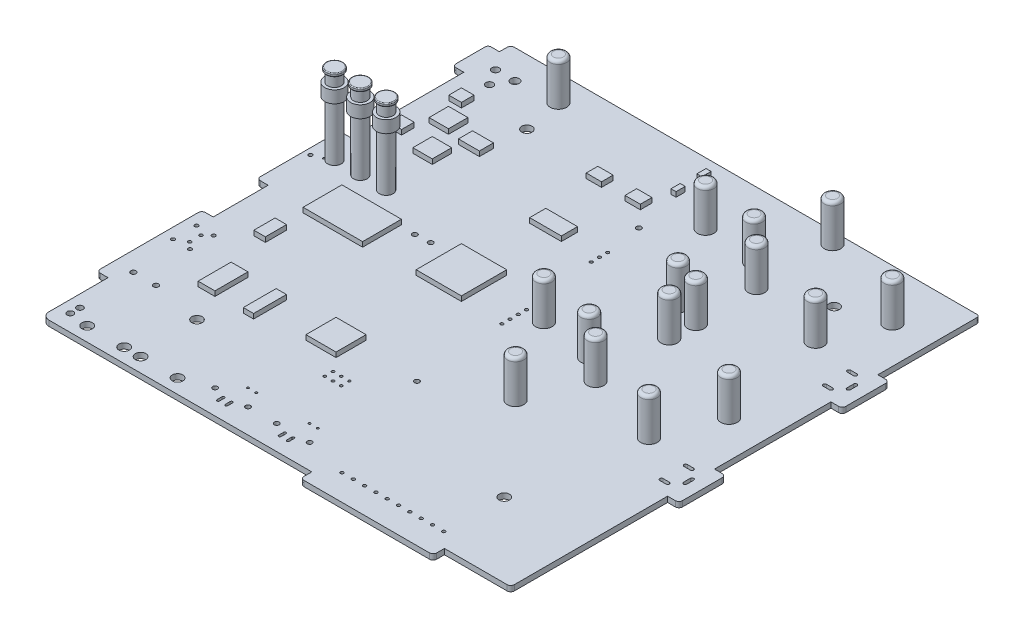
from build123d import *

# Parameters (mm, degrees)
SKETCH3_R              = 0.762
SKETCH3_R_2            = 1.6
SKETCH3_R_3            = 0.5
SKETCH3_R_4            = 0.381
SKETCH3_R_5            = 0.75
SKETCH3_R_6            = 0.3375
SKETCH3_R_7            = 1.6256
SKETCH3_R_8            = 0.9652
SKETCH3_R_9            = 0.8
SKETCH3_R_10           = 0.5625
SKETCH3_R_11           = 0.575
SKETCH3_R_12           = 0.31875
SKETCH3_R_13           = 1.125
SKETCH3_R_14           = 1.3125
BOSS_EXTRUDE1_DEPTH    = 1.7
SKETCH4_R              = 0.412418617
SKETCH4_R_2            = 0.487108602
SKETCH4_R_3            = 0.4699
SKETCH4_R_4            = 0.3175
SKETCH4_R_5            = 0.2231
SKETCH4_R_6            = 0.762
CUT_EXTRUDE1_DEPTH     = 208.557558282
BOSS_EXTRUDE2_START    = 0.5
SKETCH6_R              = 2.54
BOSS_EXTRUDE2_DEPTH    = 13
BOSS_EXTRUDE2_2_DEPTH  = 13
BOSS_EXTRUDE2_3_DEPTH  = 13
BOSS_EXTRUDE2_4_DEPTH  = 13
BOSS_EXTRUDE2_5_DEPTH  = 13
BOSS_EXTRUDE2_6_DEPTH  = 13
BOSS_EXTRUDE2_7_DEPTH  = 13
BOSS_EXTRUDE2_8_DEPTH  = 13
BOSS_EXTRUDE2_9_DEPTH  = 13
BOSS_EXTRUDE2_10_DEPTH = 13
BOSS_EXTRUDE2_11_DEPTH = 13
BOSS_EXTRUDE2_12_DEPTH = 13
BOSS_EXTRUDE2_13_DEPTH = 13
BOSS_EXTRUDE2_14_DEPTH = 13
BOSS_EXTRUDE2_15_DEPTH = 13
BOSS_EXTRUDE2_16_DEPTH = 13
FILLET1_R              = 1
FILLET2_R              = 1
FILLET3_R              = 1
FILLET4_R              = 1
FILLET5_R              = 1
FILLET6_R              = 1
FILLET7_R              = 1
FILLET8_R              = 1
FILLET9_R              = 1
FILLET10_R             = 1
FILLET11_R             = 1
FILLET12_R             = 1
FILLET13_R             = 1
FILLET14_R             = 1
FILLET15_R             = 1
FILLET16_R             = 1
SKETCH7_W              = 18.4
SKETCH7_H              = 12
BOSS_EXTRUDE3_DEPTH    = 1.5
SKETCH7_W_2            = 14
SKETCH7_H_2            = 14
BOSS_EXTRUDE3_2_DEPTH  = 1.5
SKETCH7_W_3            = 9.3
SKETCH7_H_3            = 9.3
BOSS_EXTRUDE3_3_DEPTH  = 1.5
SKETCH7_W_4            = 5.2
SKETCH7_H_4            = 10.2
BOSS_EXTRUDE3_4_DEPTH  = 1.5
SKETCH7_W_5            = 1.562
SKETCH7_H_5            = 2.845
BOSS_EXTRUDE3_5_DEPTH  = 1.5
BOSS_EXTRUDE3_6_DEPTH  = 1.5
SKETCH7_W_6            = 4.724
SKETCH7_H_6            = 3.606
BOSS_EXTRUDE3_7_DEPTH  = 1.5
BOSS_EXTRUDE3_8_DEPTH  = 1.5
SKETCH7_W_7            = 3.556
SKETCH7_H_7            = 6.554
BOSS_EXTRUDE3_9_DEPTH  = 1.5
SKETCH7_W_8            = 3.175
SKETCH7_H_8            = 10.16
BOSS_EXTRUDE3_10_DEPTH = 1.5
SKETCH7_W_9            = 9.8
SKETCH7_H_9            = 5
BOSS_EXTRUDE3_11_DEPTH = 1.5
SKETCH7_W_10           = 6.48
SKETCH7_H_10           = 4.35
BOSS_EXTRUDE3_12_DEPTH = 1.5
SKETCH7_W_11           = 3.9
SKETCH7_H_11           = 3.9
BOSS_EXTRUDE3_13_DEPTH = 1.5
SKETCH7_W_12           = 6
SKETCH7_H_12           = 6
BOSS_EXTRUDE3_14_DEPTH = 1.5
BOSS_EXTRUDE3_15_DEPTH = 1.5
BOSS_EXTRUDE3_16_DEPTH = 1.5
BOSS_EXTRUDE4_START    = 3
SKETCH9_R              = 2.1
BOSS_EXTRUDE4_DEPTH    = 25
BOSS_EXTRUDE4_2_DEPTH  = 25
BOSS_EXTRUDE4_3_DEPTH  = 25
SKETCH10_R             = 3
SKETCH10_R_2           = 2.1
BOSS_EXTRUDE5_DEPTH    = 3.75
BOSS_EXTRUDE5_2_DEPTH  = 3.75
BOSS_EXTRUDE5_3_DEPTH  = 3.75
SKETCH11_R             = 2.6
BOSS_EXTRUDE6_DEPTH    = 1
FILLET17_R             = 0.25
FILLET18_R             = 0.25
FILLET19_R             = 0.25


with BuildPart() as part:
    # Sketch3 → Boss-Extrude1 (new body)
    with BuildSketch(Plane(origin=(0, 0, 0), x_dir=(1, 0, 0), z_dir=(0, 1, 0))):
        with BuildLine():
            Line((-2.382, 130.5), (0, 130.5))
            Line((0, 130.5), (0, 95.5))
            Line((0, 95.5), (-2.382, 95.5))
            ThreePointArc((-2.382, 95.5), (-3.172545381, 95.172545381), (-3.5, 94.382))
            Line((-3.5, 94.382), (-3.5, 71.118))
            ThreePointArc((-3.5, 71.118), (-3.172545381, 70.327454619), (-2.382, 70))
            Line((-2.382, 70), (0, 70))
            Line((0, 70), (0, 53))
            Line((0, 53), (-2.382, 53))
            ThreePointArc((-2.382, 53), (-3.172545381, 52.672545381), (-3.5, 51.882))
            Line((-3.5, 51.882), (-3.5, 21.618))
            ThreePointArc((-3.5, 21.618), (-3.172545381, 20.827454619), (-2.382, 20.5))
            Line((-2.382, 20.5), (0, 20.5))
            Line((0, 20.5), (0, 2.2361))
            ThreePointArc((0, 2.2361), (0.654938527, 0.654938527), (2.2361, 0))
            Line((2.2361, 0), (83.5, 0))
            Line((83.5, 0), (83.5, -2.382))
            ThreePointArc((83.5, -2.382), (83.827454619, -3.172545381), (84.618, -3.5))
            Line((84.618, -3.5), (123.382, -3.5))
            ThreePointArc((123.382, -3.5), (124.172545381, -3.172545381), (124.5, -2.382))
            Line((124.5, -2.382), (124.5, 0))
            Line((124.5, 0), (143.882, 0))
            ThreePointArc((143.882, 0), (144.672545381, 0.327454619), (145, 1.118))
            Line((145, 1.118), (145, 48.5))
            Line((145, 48.5), (147.382, 48.5))
            ThreePointArc((147.382, 48.5), (148.172545381, 48.827454619), (148.5, 49.618))
            Line((148.5, 49.618), (148.5, 61.882))
            ThreePointArc((148.5, 61.882), (148.172545381, 62.672545381), (147.382, 63))
            Line((147.382, 63), (145, 63))
            Line((145, 63), (145, 99))
            Line((145, 99), (147.382, 99))
            ThreePointArc((147.382, 99), (148.172545381, 99.327454619), (148.5, 100.118))
            Line((148.5, 100.118), (148.5, 112.382))
            ThreePointArc((148.5, 112.382), (148.172545381, 113.172545381), (147.382, 113.5))
            Line((147.382, 113.5), (145, 113.5))
            Line((145, 113.5), (145, 144.0986))
            ThreePointArc((145, 144.0986), (144.735986053, 144.735986053), (144.0986, 145))
            Line((144.0986, 145), (1.118, 145))
            ThreePointArc((1.118, 145), (0.327454619, 144.672545381), (0, 143.882))
            Line((0, 143.882), (0, 141.5))
            Line((0, 141.5), (-2.5986, 141.5))
            ThreePointArc((-2.5986, 141.5), (-3.235986053, 141.235986053), (-3.5, 140.5986))
            Line((-3.5, 140.5986), (-3.5, 131.618))
            ThreePointArc((-3.5, 131.618), (-3.172545381, 130.827454619), (-2.382, 130.5))
        make_face()
        with Locations((40.5, 79.75)):
            Circle(SKETCH3_R, mode=Mode.SUBTRACT)
        with Locations((35.875, 79.5)):
            Circle(SKETCH3_R, mode=Mode.SUBTRACT)
        with Locations((25, 23)):
            Circle(SKETCH3_R_2, mode=Mode.SUBTRACT)
        with Locations((25, 125)):
            Circle(SKETCH3_R_2, mode=Mode.SUBTRACT)
        with Locations((120, 125)):
            Circle(SKETCH3_R_2, mode=Mode.SUBTRACT)
        with Locations((120, 23)):
            Circle(SKETCH3_R_2, mode=Mode.SUBTRACT)
        with Locations((75.5, 40.5)):
            Circle(SKETCH3_R, mode=Mode.SUBTRACT)
        with Locations((55.977, 35.0066)):
            Circle(SKETCH3_R_3, mode=Mode.SUBTRACT)
        with Locations((65.0002, 30.1361)):
            Circle(SKETCH3_R_4, mode=Mode.SUBTRACT)
        with Locations((75.275, 7.55)):
            Circle(SKETCH3_R_5, mode=Mode.SUBTRACT)
        with Locations((72.735, 12.63)):
            Circle(SKETCH3_R_6, mode=Mode.SUBTRACT)
        with Locations((70.195, 12.63)):
            Circle(SKETCH3_R_6, mode=Mode.SUBTRACT)
        with Locations((65.115, 7.55)):
            Circle(SKETCH3_R_5, mode=Mode.SUBTRACT)
        with Locations((53.685, 12.63)):
            Circle(SKETCH3_R_6, mode=Mode.SUBTRACT)
        with Locations((51.145, 12.63)):
            Circle(SKETCH3_R_6, mode=Mode.SUBTRACT)
        with Locations((56.225, 7.55)):
            Circle(SKETCH3_R_5, mode=Mode.SUBTRACT)
        with Locations((46.065, 7.55)):
            Circle(SKETCH3_R_5, mode=Mode.SUBTRACT)
        with Locations((37.592, 4.4)):
            Circle(SKETCH3_R_7, mode=Mode.SUBTRACT)
        with Locations((26.162, 4.4)):
            Circle(SKETCH3_R_7, mode=Mode.SUBTRACT)
        with Locations((21.082, 4.4)):
            Circle(SKETCH3_R_7, mode=Mode.SUBTRACT)
        with Locations((9.652, 4.4)):
            Circle(SKETCH3_R_7, mode=Mode.SUBTRACT)
        with Locations((3.7135, 5.121)):
            Circle(SKETCH3_R_8, mode=Mode.SUBTRACT)
        with Locations((3.7135, 8.0928)):
            Circle(SKETCH3_R_8, mode=Mode.SUBTRACT)
        with Locations((9.4624, 25.8572)):
            Circle(SKETCH3_R_9, mode=Mode.SUBTRACT)
        with Locations((2.4624, 25.8572)):
            Circle(SKETCH3_R_9, mode=Mode.SUBTRACT)
        with Locations((5.0334, 40.8053)):
            Circle(SKETCH3_R_10, mode=Mode.SUBTRACT)
        with Locations((3.0334, 42.7053)):
            Circle(SKETCH3_R_3, mode=Mode.SUBTRACT)
        with Locations((-0.2666, 40.8053)):
            Circle(SKETCH3_R_10, mode=Mode.SUBTRACT)
        with Locations((5.0334, 48.1053)):
            Circle(SKETCH3_R_10, mode=Mode.SUBTRACT)
        with Locations((3.0334, 46.2053)):
            Circle(SKETCH3_R_3, mode=Mode.SUBTRACT)
        with Locations((-0.2666, 48.1053)):
            Circle(SKETCH3_R_10, mode=Mode.SUBTRACT)
        with Locations((-1.5618, 84.65)):
            Circle(SKETCH3_R_11, mode=Mode.SUBTRACT)
        with Locations((1.4382, 85.825)):
            Circle(SKETCH3_R_12, mode=Mode.SUBTRACT)
        with Locations((1.4382, 90.675)):
            Circle(SKETCH3_R_12, mode=Mode.SUBTRACT)
        with Locations((-1.5618, 91.85)):
            Circle(SKETCH3_R_11, mode=Mode.SUBTRACT)
        with Locations((7.3, 131.15)):
            Circle(SKETCH3_R_13, mode=Mode.SUBTRACT)
        with Locations((10.25, 136.05)):
            Circle(SKETCH3_R_14, mode=Mode.SUBTRACT)
        with Locations((4.25, 136.05)):
            Circle(SKETCH3_R_13, mode=Mode.SUBTRACT)
    extrude(amount=-BOSS_EXTRUDE1_DEPTH)

    # Sketch4 → Cut-Extrude1 (cut, through all)
    with BuildSketch(Plane(origin=(0, 0, 0), x_dir=(1, 0, 0), z_dir=(0, 1, 0))):
        with Locations((62.4602, 30.1361)):
            Circle(SKETCH4_R)
        with Locations((59.9202, 30.1361)):
            Circle(SKETCH4_R)
        with Locations((59.9202, 27.5961)):
            Circle(SKETCH4_R)
        with Locations((62.4602, 27.5961)):
            Circle(SKETCH4_R)
        with Locations((65.0002, 27.5961)):
            Circle(SKETCH4_R)
        with Locations((88.3646, 4.4502)):
            Circle(SKETCH4_R_2)
        with Locations((91.8646, 4.4502)):
            Circle(SKETCH4_R_2)
        with Locations((95.3646, 4.4502)):
            Circle(SKETCH4_R_2)
        with Locations((98.8646, 4.4502)):
            Circle(SKETCH4_R_2)
        with Locations((102.3646, 4.4502)):
            Circle(SKETCH4_R_2)
        with Locations((105.8646, 4.4502)):
            Circle(SKETCH4_R_2)
        with Locations((109.3646, 4.4502)):
            Circle(SKETCH4_R_2)
        with Locations((112.8646, 4.4502)):
            Circle(SKETCH4_R_2)
        with Locations((116.3646, 4.4502)):
            Circle(SKETCH4_R_2)
        with Locations((119.8646, 4.4502)):
            Circle(SKETCH4_R_2)
        with Locations((73.25, 81.7)):
            Circle(SKETCH4_R_3)
        with Locations((73.25, 79.16)):
            Circle(SKETCH4_R_3)
        with Locations((73.25, 76.62)):
            Circle(SKETCH4_R_3)
        with Locations((73.25, 74.08)):
            Circle(SKETCH4_R_3)
        with Locations((73.25, 71.54)):
            Circle(SKETCH4_R_3)
        with Locations((73.25, 69)):
            Circle(SKETCH4_R_3)
        with Locations((128.016, 112.25)):
            Circle(SKETCH4_R_4)
        with Locations((134, 127.984)):
            Circle(SKETCH4_R_4)
        with Locations((103.5, 139.984)):
            Circle(SKETCH4_R_4)
        with Locations((103.5, 116.484)):
            Circle(SKETCH4_R_4)
        with Locations((79.75, 124.484)):
            Circle(SKETCH4_R_4)
        with Locations((70.5, 99.38)):
            Circle(SKETCH4_R_3)
        with Locations((70.5, 101.92)):
            Circle(SKETCH4_R_3)
        with Locations((59.706, 104.528)):
            Circle(SKETCH4_R_5)
        with Locations((70.5, 104.46)):
            Circle(SKETCH4_R_3)
        with Locations((68.75, 115.875)):
            Circle(SKETCH4_R_6)
        with BuildLine():
            Line((50.256, 6.223), (50.256, 4.699))
            ThreePointArc((50.256, 4.699), (49.875, 4.318), (49.494, 4.699))
            Line((49.494, 4.699), (49.494, 6.223))
            ThreePointArc((49.494, 6.223), (49.875, 6.604), (50.256, 6.223))
        make_face()
        with BuildLine():
            Line((52.796, 6.223), (52.796, 4.699))
            ThreePointArc((52.796, 4.699), (52.415, 4.318), (52.034, 4.699))
            Line((52.034, 4.699), (52.034, 6.223))
            ThreePointArc((52.034, 6.223), (52.415, 6.604), (52.796, 6.223))
        make_face()
        with BuildLine():
            Line((69.306, 6.223), (69.306, 4.699))
            ThreePointArc((69.306, 4.699), (68.925, 4.318), (68.544, 4.699))
            Line((68.544, 4.699), (68.544, 6.223))
            ThreePointArc((68.544, 6.223), (68.925, 6.604), (69.306, 6.223))
        make_face()
        with BuildLine():
            Line((71.846, 6.223), (71.846, 4.699))
            ThreePointArc((71.846, 4.699), (71.465, 4.318), (71.084, 4.699))
            Line((71.084, 4.699), (71.084, 6.223))
            ThreePointArc((71.084, 6.223), (71.465, 6.604), (71.846, 6.223))
        make_face()
        with BuildLine():
            Line((139.575, 60.025), (141.525, 60.025))
            ThreePointArc((141.525, 60.025), (142.05, 59.5), (141.525, 58.975))
            Line((141.525, 58.975), (139.575, 58.975))
            ThreePointArc((139.575, 58.975), (139.05, 59.5), (139.575, 60.025))
        make_face()
        with BuildLine():
            Line((144.775, 56.8), (144.775, 54.7))
            ThreePointArc((144.775, 54.7), (144.25, 54.175), (143.725, 54.7))
            Line((143.725, 54.7), (143.725, 56.8))
            ThreePointArc((143.725, 56.8), (144.25, 57.325), (144.775, 56.8))
        make_face()
        with BuildLine():
            Line((139.575, 52.525), (141.525, 52.525))
            ThreePointArc((141.525, 52.525), (142.05, 52), (141.525, 51.475))
            Line((141.525, 51.475), (139.575, 51.475))
            ThreePointArc((139.575, 51.475), (139.05, 52), (139.575, 52.525))
        make_face()
        with BuildLine():
            Line((139.575, 110.525), (141.525, 110.525))
            ThreePointArc((141.525, 110.525), (142.05, 110), (141.525, 109.475))
            Line((141.525, 109.475), (139.575, 109.475))
            ThreePointArc((139.575, 109.475), (139.05, 110), (139.575, 110.525))
        make_face()
        with BuildLine():
            Line((144.775, 107.3), (144.775, 105.2))
            ThreePointArc((144.775, 105.2), (144.25, 104.675), (143.725, 105.2))
            Line((143.725, 105.2), (143.725, 107.3))
            ThreePointArc((143.725, 107.3), (144.25, 107.825), (144.775, 107.3))
        make_face()
        with BuildLine():
            Line((139.575, 103.025), (141.525, 103.025))
            ThreePointArc((141.525, 103.025), (142.05, 102.5), (141.525, 101.975))
            Line((141.525, 101.975), (139.575, 101.975))
            ThreePointArc((139.575, 101.975), (139.05, 102.5), (139.575, 103.025))
        make_face()
    extrude(amount=-CUT_EXTRUDE1_DEPTH, mode=Mode.SUBTRACT)


with BuildPart() as body_2:
    # Sketch6 → Boss-Extrude2 (new body)
    with BuildSketch(Plane(origin=(0, 0, 0), x_dir=(1, 0, 0), z_dir=(0, 1, 0)).offset(BOSS_EXTRUDE2_START)):
        with Locations((96.25, 50.25)):
            Circle(SKETCH6_R)
    extrude(amount=BOSS_EXTRUDE2_DEPTH)

    # Fillet16
    fillet16_edges = [body_2.edges().sort_by_distance(p)[0] for p in [
        (93.71, 13.5, -50.25),
    ]]
    fillet(fillet16_edges, radius=FILLET16_R)


with BuildPart() as body_3:
    # Sketch6 → Boss-Extrude2 2 (new body)
    with BuildSketch(Plane(origin=(0, 0, 0), x_dir=(1, 0, 0), z_dir=(0, 1, 0)).offset(BOSS_EXTRUDE2_START)):
        with Locations((79.75, 75.5)):
            Circle(SKETCH6_R)
    extrude(amount=BOSS_EXTRUDE2_2_DEPTH)

    # Fillet12
    fillet12_edges = [body_3.edges().sort_by_distance(p)[0] for p in [
        (77.21, 13.5, -75.5),
    ]]
    fillet(fillet12_edges, radius=FILLET12_R)


with BuildPart() as body_4:
    # Sketch6 → Boss-Extrude2 3 (new body)
    with BuildSketch(Plane(origin=(0, 0, 0), x_dir=(1, 0, 0), z_dir=(0, 1, 0)).offset(BOSS_EXTRUDE2_START)):
        with Locations((96.25, 73)):
            Circle(SKETCH6_R)
    extrude(amount=BOSS_EXTRUDE2_3_DEPTH)

    # Fillet13
    fillet13_edges = [body_4.edges().sort_by_distance(p)[0] for p in [
        (93.71, 13.5, -73),
    ]]
    fillet(fillet13_edges, radius=FILLET13_R)


with BuildPart() as body_5:
    # Sketch6 → Boss-Extrude2 4 (new body)
    with BuildSketch(Plane(origin=(0, 0, 0), x_dir=(1, 0, 0), z_dir=(0, 1, 0)).offset(BOSS_EXTRUDE2_START)):
        with Locations((103.5, 67.75)):
            Circle(SKETCH6_R)
    extrude(amount=BOSS_EXTRUDE2_4_DEPTH)

    # Fillet14
    fillet14_edges = [body_5.edges().sort_by_distance(p)[0] for p in [
        (100.96, 13.5, -67.75),
    ]]
    fillet(fillet14_edges, radius=FILLET14_R)


with BuildPart() as body_6:
    # Sketch6 → Boss-Extrude2 5 (new body)
    with BuildSketch(Plane(origin=(0, 0, 0), x_dir=(1, 0, 0), z_dir=(0, 1, 0)).offset(BOSS_EXTRUDE2_START)):
        with Locations((127, 60.75)):
            Circle(SKETCH6_R)
    extrude(amount=BOSS_EXTRUDE2_5_DEPTH)

    # Fillet15
    fillet15_edges = [body_6.edges().sort_by_distance(p)[0] for p in [
        (124.46, 13.5, -60.75),
    ]]
    fillet(fillet15_edges, radius=FILLET15_R)


with BuildPart() as body_7:
    # Sketch6 → Boss-Extrude2 6 (new body)
    with BuildSketch(Plane(origin=(0, 0, 0), x_dir=(1, 0, 0), z_dir=(0, 1, 0)).offset(BOSS_EXTRUDE2_START)):
        with Locations((134, 78.5)):
            Circle(SKETCH6_R)
    extrude(amount=BOSS_EXTRUDE2_6_DEPTH)

    # Fillet11
    fillet11_edges = [body_7.edges().sort_by_distance(p)[0] for p in [
        (131.46, 13.5, -78.5),
    ]]
    fillet(fillet11_edges, radius=FILLET11_R)


with BuildPart() as body_8:
    # Sketch6 → Boss-Extrude2 7 (new body)
    with BuildSketch(Plane(origin=(0, 0, 0), x_dir=(1, 0, 0), z_dir=(0, 1, 0)).offset(BOSS_EXTRUDE2_START)):
        with Locations((103.5, 90.5)):
            Circle(SKETCH6_R)
    extrude(amount=BOSS_EXTRUDE2_7_DEPTH)

    # Fillet10
    fillet10_edges = [body_8.edges().sort_by_distance(p)[0] for p in [
        (100.96, 13.5, -90.5),
    ]]
    fillet(fillet10_edges, radius=FILLET10_R)


with BuildPart() as body_9:
    # Sketch6 → Boss-Extrude2 8 (new body)
    with BuildSketch(Plane(origin=(0, 0, 0), x_dir=(1, 0, 0), z_dir=(0, 1, 0)).offset(BOSS_EXTRUDE2_START)):
        with Locations((103.75, 98.5)):
            Circle(SKETCH6_R)
    extrude(amount=BOSS_EXTRUDE2_8_DEPTH)

    # Fillet9
    fillet9_edges = [body_9.edges().sort_by_distance(p)[0] for p in [
        (101.21, 13.5, -98.5),
    ]]
    fillet(fillet9_edges, radius=FILLET9_R)


with BuildPart() as body_10:
    # Sketch6 → Boss-Extrude2 9 (new body)
    with BuildSketch(Plane(origin=(0, 0, 0), x_dir=(1, 0, 0), z_dir=(0, 1, 0)).offset(BOSS_EXTRUDE2_START)):
        with Locations((96.25, 100.5)):
            Circle(SKETCH6_R)
    extrude(amount=BOSS_EXTRUDE2_9_DEPTH)

    # Fillet8
    fillet8_edges = [body_10.edges().sort_by_distance(p)[0] for p in [
        (93.71, 13.5, -100.5),
    ]]
    fillet(fillet8_edges, radius=FILLET8_R)


with BuildPart() as body_11:
    # Sketch6 → Boss-Extrude2 10 (new body)
    with BuildSketch(Plane(origin=(0, 0, 0), x_dir=(1, 0, 0), z_dir=(0, 1, 0)).offset(BOSS_EXTRUDE2_START)):
        with Locations((134, 129)):
            Circle(SKETCH6_R)
    extrude(amount=BOSS_EXTRUDE2_10_DEPTH)

    # Fillet4
    fillet4_edges = [body_11.edges().sort_by_distance(p)[0] for p in [
        (131.46, 13.5, -129),
    ]]
    fillet(fillet4_edges, radius=FILLET4_R)


with BuildPart() as body_12:
    # Sketch6 → Boss-Extrude2 11 (new body)
    with BuildSketch(Plane(origin=(0, 0, 0), x_dir=(1, 0, 0), z_dir=(0, 1, 0)).offset(BOSS_EXTRUDE2_START)):
        with Locations((127, 112.25)):
            Circle(SKETCH6_R)
    extrude(amount=BOSS_EXTRUDE2_11_DEPTH)

    # Fillet7
    fillet7_edges = [body_12.edges().sort_by_distance(p)[0] for p in [
        (124.46, 13.5, -112.25),
    ]]
    fillet(fillet7_edges, radius=FILLET7_R)


with BuildPart() as body_13:
    # Sketch6 → Boss-Extrude2 12 (new body)
    with BuildSketch(Plane(origin=(0, 0, 0), x_dir=(1, 0, 0), z_dir=(0, 1, 0)).offset(BOSS_EXTRUDE2_START)):
        with Locations((103.5, 117.5)):
            Circle(SKETCH6_R)
    extrude(amount=BOSS_EXTRUDE2_12_DEPTH)

    # Fillet6
    fillet6_edges = [body_13.edges().sort_by_distance(p)[0] for p in [
        (100.96, 13.5, -117.5),
    ]]
    fillet(fillet6_edges, radius=FILLET6_R)


with BuildPart() as body_14:
    # Sketch6 → Boss-Extrude2 13 (new body)
    with BuildSketch(Plane(origin=(0, 0, 0), x_dir=(1, 0, 0), z_dir=(0, 1, 0)).offset(BOSS_EXTRUDE2_START)):
        with Locations((96.25, 124)):
            Circle(SKETCH6_R)
    extrude(amount=BOSS_EXTRUDE2_13_DEPTH)

    # Fillet5
    fillet5_edges = [body_14.edges().sort_by_distance(p)[0] for p in [
        (93.71, 13.5, -124),
    ]]
    fillet(fillet5_edges, radius=FILLET5_R)


with BuildPart() as body_15:
    # Sketch6 → Boss-Extrude2 14 (new body)
    with BuildSketch(Plane(origin=(0, 0, 0), x_dir=(1, 0, 0), z_dir=(0, 1, 0)).offset(BOSS_EXTRUDE2_START)):
        with Locations((103.5, 141)):
            Circle(SKETCH6_R)
    extrude(amount=BOSS_EXTRUDE2_14_DEPTH)

    # Fillet3
    fillet3_edges = [body_15.edges().sort_by_distance(p)[0] for p in [
        (100.96, 13.5, -141),
    ]]
    fillet(fillet3_edges, radius=FILLET3_R)


with BuildPart() as body_16:
    # Sketch6 → Boss-Extrude2 15 (new body)
    with BuildSketch(Plane(origin=(0, 0, 0), x_dir=(1, 0, 0), z_dir=(0, 1, 0)).offset(BOSS_EXTRUDE2_START)):
        with Locations((79.75, 125.5)):
            Circle(SKETCH6_R)
    extrude(amount=BOSS_EXTRUDE2_15_DEPTH)

    # Fillet2
    fillet2_edges = [body_16.edges().sort_by_distance(p)[0] for p in [
        (77.21, 13.5, -125.5),
    ]]
    fillet(fillet2_edges, radius=FILLET2_R)


with BuildPart() as body_17:
    # Sketch6 → Boss-Extrude2 16 (new body)
    with BuildSketch(Plane(origin=(0, 0, 0), x_dir=(1, 0, 0), z_dir=(0, 1, 0)).offset(BOSS_EXTRUDE2_START)):
        with Locations((23.25, 136.5)):
            Circle(SKETCH6_R)
    extrude(amount=BOSS_EXTRUDE2_16_DEPTH)

    # Fillet1
    fillet1_edges = [body_17.edges().sort_by_distance(p)[0] for p in [
        (20.71, 13.5, -136.5),
    ]]
    fillet(fillet1_edges, radius=FILLET1_R)


with BuildPart() as body_18:
    # Sketch7 → Boss-Extrude3 (new body)
    with BuildSketch(Plane(origin=(0, 0, 0), x_dir=(1, 0, 0), z_dir=(0, 1, 0))):
        with Locations((22, 74)):
            Rectangle(SKETCH7_W, SKETCH7_H)
    extrude(amount=BOSS_EXTRUDE3_DEPTH)


with BuildPart() as body_19:
    # Sketch7 → Boss-Extrude3 2 (new body)
    with BuildSketch(Plane(origin=(0, 0, 0), x_dir=(1, 0, 0), z_dir=(0, 1, 0))):
        with Locations((54, 75.75)):
            Rectangle(SKETCH7_W_2, SKETCH7_H_2)
    extrude(amount=BOSS_EXTRUDE3_2_DEPTH)


with BuildPart() as body_20:
    # Sketch7 → Boss-Extrude3 3 (new body)
    with BuildSketch(Plane(origin=(0, 0, 0), x_dir=(1, 0, 0), z_dir=(0, 1, 0))):
        with Locations((52.002, 38.9816)):
            Rectangle(SKETCH7_W_3, SKETCH7_H_3)
    extrude(amount=BOSS_EXTRUDE3_3_DEPTH)


with BuildPart() as body_21:
    # Sketch7 → Boss-Extrude3 4 (new body)
    with BuildSketch(Plane(origin=(0, 0, 0), x_dir=(1, 0, 0), z_dir=(0, 1, 0))):
        with Locations((18.9548, 37.0893)):
            Rectangle(SKETCH7_W_4, SKETCH7_H_4)
    extrude(amount=BOSS_EXTRUDE3_4_DEPTH)


with BuildPart() as body_22:
    # Sketch7 → Boss-Extrude3 5 (new body)
    with BuildSketch(Plane(origin=(0, 0, 0), x_dir=(1, 0, 0), z_dir=(0, 1, 0))):
        with Locations((65.5, 139.2505)):
            Rectangle(SKETCH7_W_5, SKETCH7_H_5)
    extrude(amount=BOSS_EXTRUDE3_5_DEPTH)


with BuildPart() as body_23:
    # Sketch7 → Boss-Extrude3 6 (new body)
    with BuildSketch(Plane(origin=(0, 0, 0), x_dir=(1, 0, 0), z_dir=(0, 1, 0))):
        with Locations((65.5, 131.2505)):
            Rectangle(SKETCH7_W_5, SKETCH7_H_5)
    extrude(amount=BOSS_EXTRUDE3_6_DEPTH)


with BuildPart() as body_24:
    # Sketch7 → Boss-Extrude3 7 (new body)
    with BuildSketch(Plane(origin=(0, 0, 0), x_dir=(1, 0, 0), z_dir=(0, 1, 0))):
        with Locations((61.75, 122.75)):
            Rectangle(SKETCH7_W_6, SKETCH7_H_6)
    extrude(amount=BOSS_EXTRUDE3_7_DEPTH)


with BuildPart() as body_25:
    # Sketch7 → Boss-Extrude3 8 (new body)
    with BuildSketch(Plane(origin=(0, 0, 0), x_dir=(1, 0, 0), z_dir=(0, 1, 0))):
        with Locations((49.75, 122.75)):
            Rectangle(SKETCH7_W_6, SKETCH7_H_6)
    extrude(amount=BOSS_EXTRUDE3_8_DEPTH)


with BuildPart() as body_26:
    # Sketch7 → Boss-Extrude3 9 (new body)
    with BuildSketch(Plane(origin=(0, 0, 0), x_dir=(1, 0, 0), z_dir=(0, 1, 0))):
        with Locations((13.11, 57.53)):
            Rectangle(SKETCH7_W_7, SKETCH7_H_7)
    extrude(amount=BOSS_EXTRUDE3_9_DEPTH)


with BuildPart() as body_27:
    # Sketch7 → Boss-Extrude3 10 (new body)
    with BuildSketch(Plane(origin=(0, 0, 0), x_dir=(1, 0, 0), z_dir=(0, 1, 0))):
        with Locations((31.9983, 36.992)):
            Rectangle(SKETCH7_W_8, SKETCH7_H_8)
    extrude(amount=BOSS_EXTRUDE3_10_DEPTH)


with BuildPart() as body_28:
    # Sketch7 → Boss-Extrude3 11 (new body)
    with BuildSketch(Plane(origin=(0, 0, 0), x_dir=(1, 0, 0), z_dir=(0, 1, 0))):
        with Locations((55.5, 102.75)):
            Rectangle(SKETCH7_W_9, SKETCH7_H_9)
    extrude(amount=BOSS_EXTRUDE3_11_DEPTH)


with BuildPart() as body_29:
    # Sketch7 → Boss-Extrude3 12 (new body)
    with BuildSketch(Plane(origin=(0, 0, 0), x_dir=(1, 0, 0), z_dir=(0, 1, 0))):
        with Locations((21.75, 112.5)):
            Rectangle(SKETCH7_W_10, SKETCH7_H_10)
    extrude(amount=BOSS_EXTRUDE3_12_DEPTH)


with BuildPart() as body_30:
    # Sketch7 → Boss-Extrude3 13 (new body)
    with BuildSketch(Plane(origin=(0, 0, 0), x_dir=(1, 0, 0), z_dir=(0, 1, 0))):
        with Locations((7.25, 122.5)):
            Rectangle(SKETCH7_W_11, SKETCH7_H_11)
    extrude(amount=BOSS_EXTRUDE3_13_DEPTH)


with BuildPart() as body_31:
    # Sketch7 → Boss-Extrude3 14 (new body)
    with BuildSketch(Plane(origin=(0, 0, 0), x_dir=(1, 0, 0), z_dir=(0, 1, 0))):
        with Locations((11.25, 114.5)):
            Rectangle(SKETCH7_W_12, SKETCH7_H_12)
    extrude(amount=BOSS_EXTRUDE3_14_DEPTH)


with BuildPart() as body_32:
    # Sketch7 → Boss-Extrude3 15 (new body)
    with BuildSketch(Plane(origin=(0, 0, 0), x_dir=(1, 0, 0), z_dir=(0, 1, 0))):
        with Locations((16.816, 103.9248)):
            Rectangle(SKETCH7_W_12, SKETCH7_H_12)
    extrude(amount=BOSS_EXTRUDE3_15_DEPTH)


with BuildPart() as body_33:
    # Sketch7 → Boss-Extrude3 16 (new body)
    with BuildSketch(Plane(origin=(0, 0, 0), x_dir=(1, 0, 0), z_dir=(0, 1, 0))):
        with Locations((5.25, 106)):
            Rectangle(SKETCH7_W_11, SKETCH7_H_11)
    extrude(amount=BOSS_EXTRUDE3_16_DEPTH)


with BuildPart() as body_34:
    # Sketch9 → Boss-Extrude4 (new body)
    with BuildSketch(Plane(origin=(0, 0, 0), x_dir=(1, 0, 0), z_dir=(0, 1, 0)).offset(BOSS_EXTRUDE4_START)):
        with Locations((6.5, 84.002)):
            Circle(SKETCH9_R)
    extrude(amount=BOSS_EXTRUDE4_DEPTH)



with BuildPart() as body_35:
    # Sketch9 → Boss-Extrude4 2 (new body)
    with BuildSketch(Plane(origin=(0, 0, 0), x_dir=(1, 0, 0), z_dir=(0, 1, 0)).offset(BOSS_EXTRUDE4_START)):
        with Locations((14.5, 84.002)):
            Circle(SKETCH9_R)
    extrude(amount=BOSS_EXTRUDE4_2_DEPTH)


with BuildPart() as body_36:
    # Sketch9 → Boss-Extrude4 3 (new body)
    with BuildSketch(Plane(origin=(0, 0, 0), x_dir=(1, 0, 0), z_dir=(0, 1, 0)).offset(BOSS_EXTRUDE4_START)):
        with Locations((22.5, 84.002)):
            Circle(SKETCH9_R)
    extrude(amount=BOSS_EXTRUDE4_3_DEPTH)


with BuildPart() as body_37:
    # Sketch10 → Boss-Extrude5 (new body)
    with BuildSketch(Plane(origin=(0, 23.9, 0), x_dir=(1, 0, 0), z_dir=(0, 1, 0))):
        with Locations((6.5, 84.002)):
            Circle(SKETCH10_R)
        with Locations((6.5, 84.002)):
            Circle(SKETCH10_R_2, mode=Mode.SUBTRACT)
    extrude(amount=-BOSS_EXTRUDE5_DEPTH)


with BuildPart() as body_38:
    # Sketch10 → Boss-Extrude5 2 (new body)
    with BuildSketch(Plane(origin=(0, 23.9, 0), x_dir=(1, 0, 0), z_dir=(0, 1, 0))):
        with Locations((14.5, 84.002)):
            Circle(SKETCH10_R)
        with Locations((14.5, 84.002)):
            Circle(SKETCH10_R_2, mode=Mode.SUBTRACT)
    extrude(amount=-BOSS_EXTRUDE5_2_DEPTH)


with BuildPart() as body_39:
    # Sketch10 → Boss-Extrude5 3 (new body)
    with BuildSketch(Plane(origin=(0, 23.9, 0), x_dir=(1, 0, 0), z_dir=(0, 1, 0))):
        with Locations((22.5, 84.002)):
            Circle(SKETCH10_R)
        with Locations((22.5, 84.002)):
            Circle(SKETCH10_R_2, mode=Mode.SUBTRACT)
    extrude(amount=-BOSS_EXTRUDE5_3_DEPTH)


with BuildPart() as body_34_1:
    add(body_34.part)

    add(body_35.part)  # Boss-Extrude6 merges body 35

    add(body_36.part)  # Boss-Extrude6 merges body 36
    # Sketch11 → Boss-Extrude6 (add)
    with BuildSketch(Plane(origin=(0, 28, 0), x_dir=(1, 0, 0), z_dir=(0, 1, 0))):
        with Locations((6.5, 84.002)):
            Circle(SKETCH11_R)
        with Locations((14.5, 84.002)):
            Circle(SKETCH11_R)
        with Locations((22.5, 84.002)):
            Circle(SKETCH11_R)
    extrude(amount=-BOSS_EXTRUDE6_DEPTH)

    # Fillet17
    fillet17_edges = [body_34_1.edges().sort_by_distance(p)[0] for p in [
        (3.9, 28, -84.002),
        (3.9, 27, -84.002),
    ]]
    fillet(fillet17_edges, radius=FILLET17_R)

    # Fillet18
    fillet18_edges = [body_34_1.edges().sort_by_distance(p)[0] for p in [
        (11.9, 27, -84.002),
        (11.9, 28, -84.002),
    ]]
    fillet(fillet18_edges, radius=FILLET18_R)

    # Fillet19
    fillet19_edges = [body_34_1.edges().sort_by_distance(p)[0] for p in [
        (19.9, 28, -84.002),
        (19.9, 27, -84.002),
    ]]
    fillet(fillet19_edges, radius=FILLET19_R)


solid = Compound([part.part, body_2.part, body_3.part, body_4.part, body_5.part, body_6.part, body_7.part, body_8.part, body_9.part, body_10.part, body_11.part, body_12.part, body_13.part, body_14.part, body_15.part, body_16.part, body_17.part, body_18.part, body_19.part, body_20.part, body_21.part, body_22.part, body_23.part, body_24.part, body_25.part, body_26.part, body_27.part, body_28.part, body_29.part, body_30.part, body_31.part, body_32.part, body_33.part, body_37.part, body_38.part, body_39.part, body_34_1.part])
